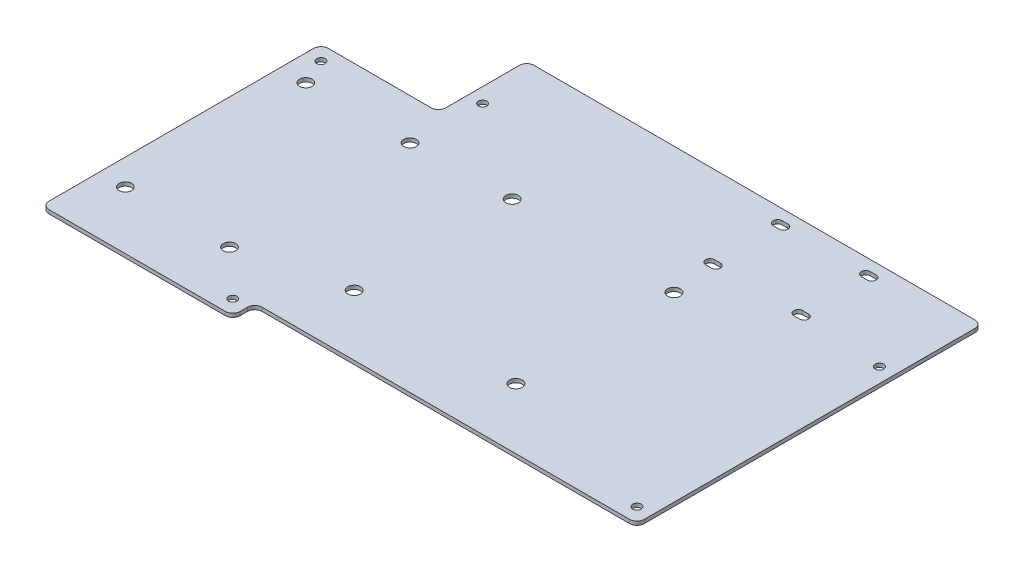
from build123d import *

# Parameters (mm, degrees)
BOSS_EXTRUDE1_DEPTH            = 1.6002
SKETCH3_W                      = 165.1
SKETCH3_H                      = 9.525
CUT_EXTRUDE1_DEPTH             = 295.167716856
FILLET1_R                      = 3.175
FUSE_ZIPTIE_MOUNTS_DEPTH       = 295.167716856
SKETCH5_R                      = 2.75
CONTACTOR_MOUNTING_HOLES_DEPTH = 295.167716856
SKETCH6_R                      = 1.8288
CUT_EXTRUDE2_DEPTH             = 295.167716856
SKETCH7_R                      = 2.7051
CUT_EXTRUDE3_DEPTH             = 295.167716856


with BuildPart() as part:
    # Sketch1 → Boss-Extrude1 (new body)
    with BuildSketch(Plane(origin=(0, 0, 0), x_dir=(1, 0, 0), z_dir=(0, 1, 0))):
        Polygon((0, 120.65), (0, 0), (247.65, 0), (247.65, 158.75), (50.8, 158.75), (50.8, 120.65), align=None)
    extrude(amount=BOSS_EXTRUDE1_DEPTH)

    # Sketch3 → Cut-Extrude1 (cut, through all)
    with BuildSketch(Plane(origin=(0, 1.6002, 0), x_dir=(1, 0, 0), z_dir=(0, 1, 0))):
        with Locations((165.1, 4.7625)):
            Rectangle(SKETCH3_W, SKETCH3_H)
    extrude(amount=-CUT_EXTRUDE1_DEPTH, mode=Mode.SUBTRACT)

    # Fillet1
    fillet1_edges = [part.edges().sort_by_distance(p)[0] for p in [
        (82.55, 0.8001, 0),
        (0, 0.8001, -120.65),
        (50.8, 0.8001, -120.65),
        (50.8, 0.8001, -158.75),
        (247.65, 0.8001, -158.75),
        (247.65, 0.8001, -9.525),
        (82.55, 0.8001, -9.525),
        (0, 0.8001, 0),
    ]]
    fillet(fillet1_edges, radius=FILLET1_R)

    # Sketch4 → Fuse Ziptie Mounts (cut, through all)
    with BuildSketch(Plane(origin=(0, 1.6002, 0), x_dir=(1, 0, 0), z_dir=(0, 1, 0))):
        with BuildLine():
            Line((165.653, 154.225), (168.193, 154.225))
            ThreePointArc((168.193, 154.225), (170.098, 152.32), (168.193, 150.415))
            Line((168.193, 150.415), (165.653, 150.415))
            ThreePointArc((165.653, 150.415), (163.748, 152.32), (165.653, 154.225))
        make_face()
        with BuildLine():
            Line((203.753, 154.225), (206.293, 154.225))
            ThreePointArc((206.293, 154.225), (208.198, 152.32), (206.293, 150.415))
            Line((206.293, 150.415), (203.753, 150.415))
            ThreePointArc((203.753, 150.415), (201.848, 152.32), (203.753, 154.225))
        make_face()
        with BuildLine():
            Line((203.753, 125.015), (206.293, 125.015))
            ThreePointArc((206.293, 125.015), (208.198, 123.11), (206.293, 121.205))
            Line((206.293, 121.205), (203.753, 121.205))
            ThreePointArc((203.753, 121.205), (201.848, 123.11), (203.753, 125.015))
        make_face()
        with BuildLine():
            Line((165.653, 125.015), (168.193, 125.015))
            ThreePointArc((168.193, 125.015), (170.098, 123.11), (168.193, 121.205))
            Line((168.193, 121.205), (165.653, 121.205))
            ThreePointArc((165.653, 121.205), (163.748, 123.11), (165.653, 125.015))
        make_face()
    extrude(amount=-FUSE_ZIPTIE_MOUNTS_DEPTH, mode=Mode.SUBTRACT)

    # Sketch5 → Contactor Mounting Holes (cut, through all)
    with BuildSketch(Plane(origin=(0, 1.6002, 0), x_dir=(1, 0, 0), z_dir=(0, 1, 0))):
        with Locations((99.298, 103.9876)):
            Circle(SKETCH5_R)
        with Locations((99.298, 35.7124)):
            Circle(SKETCH5_R)
        with Locations((169.148, 103.9876)):
            Circle(SKETCH5_R)
        with Locations((169.148, 35.7124)):
            Circle(SKETCH5_R)
    extrude(amount=-CONTACTOR_MOUNTING_HOLES_DEPTH, mode=Mode.SUBTRACT)

    # Sketch6 → Cut-Extrude2 (cut, through all)
    with BuildSketch(Plane(origin=(0, 1.6002, 0), x_dir=(1, 0, 0), z_dir=(0, 1, 0))):
        with Locations((6.35, 114.3)):
            Circle(SKETCH6_R)
        with Locations((76.2, 6.35)):
            Circle(SKETCH6_R)
        with Locations((241.3, 15.875)):
            Circle(SKETCH6_R)
        with Locations((241.3, 120.65)):
            Circle(SKETCH6_R)
        with Locations((57.15, 133.35)):
            Circle(SKETCH6_R)
    extrude(amount=-CUT_EXTRUDE2_DEPTH, mode=Mode.SUBTRACT)

    # Sketch7 → Cut-Extrude3 (cut, through all)
    with BuildSketch(Plane(origin=(0, 1.6002, 0), x_dir=(1, 0, 0), z_dir=(0, 1, 0))):
        with Locations((11.198001636, 102.950001636)):
            Circle(SKETCH7_R)
        with Locations((56.198001636, 102.950001636)):
            Circle(SKETCH7_R)
        with Locations((11.198001636, 24.950001636)):
            Circle(SKETCH7_R)
        with Locations((56.198001636, 24.950001636)):
            Circle(SKETCH7_R)
    extrude(amount=-CUT_EXTRUDE3_DEPTH, mode=Mode.SUBTRACT)


solid = part.part
